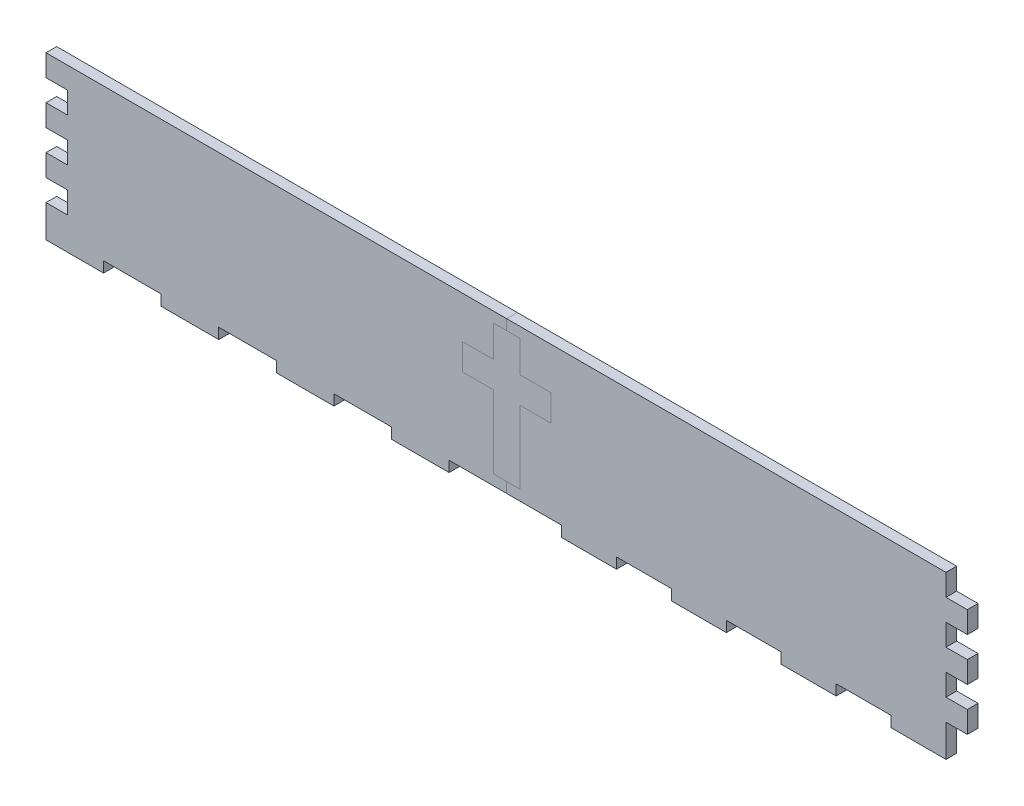
from build123d import *

# Parameters (mm, degrees)
SKETCH1_W             = 444.5
SKETCH1_H             = 73.025
BOSS_EXTRUDE1_DEPTH   = 5.15
SKETCH3_W             = 3.175
SKETCH3_H             = 73.025
BOSS_EXTRUDE2_DEPTH   = 441.325
SKETCH4_W             = 3.175
SKETCH4_H             = 73.025
BOSS_EXTRUDE3_DEPTH   = 438.15
SPLIT2_DEPTH          = 73.025
SPLIT2_START          = 5
SPLIT2_2_OUTLINE_W    = 6.35
SPLIT2_2_OUTLINE_H    = 5.15
SPLIT2_2_OUTLINE_H_2  = 3.175
SPLIT2_2_DEPTH        = 63.025
SPLIT2_START_2        = 40.085
SPLIT2_3_OUTLINE_W    = 15
SPLIT2_3_OUTLINE_H    = 5.15
SPLIT2_3_OUTLINE_H_2  = 3.175
SPLIT2_3_DEPTH        = 12.7
SPLIT2_START_3        = 215.9
SPLIT2_4_OUTLINE_W    = 63.025
SPLIT2_4_OUTLINE_H    = 5.15
SPLIT2_4_DEPTH        = 12.7
SPLIT2_START_4        = 200.9
SPLIT2_5_OUTLINE_W    = 12.7
SPLIT2_5_OUTLINE_H    = 5.15
SPLIT2_5_DEPTH        = 42.7
SPLIT2_6_DEPTH        = 73.025
SPLIT2_7_OUTLINE_W    = 15
SPLIT2_7_OUTLINE_H    = 5.15
SPLIT2_7_OUTLINE_H_2  = 3.175
SPLIT2_7_DEPTH        = 40.085
SPLIT2_START_5        = 52.785
SPLIT2_8_OUTLINE_W    = 15
SPLIT2_8_OUTLINE_H    = 5.15
SPLIT2_8_OUTLINE_H_2  = 3.175
SPLIT2_8_DEPTH        = 20.24
SPLIT2_9_OUTLINE_W    = 6.35
SPLIT2_9_OUTLINE_H    = 5.15
SPLIT2_9_OUTLINE_H_2  = 3.175
SPLIT2_9_DEPTH        = 5
SPLIT2_START_6        = 68.025
SPLIT2_10_OUTLINE_W   = 6.35
SPLIT2_10_OUTLINE_H   = 5.15
SPLIT2_10_OUTLINE_H_2 = 3.175
SPLIT2_10_DEPTH       = 5
SPLIT2_11_OUTLINE_W   = 63.025
SPLIT2_11_OUTLINE_H   = 3.175
SPLIT2_11_DEPTH       = 12.7
SPLIT2_12_OUTLINE_W   = 12.7
SPLIT2_12_OUTLINE_H   = 3.175
SPLIT2_12_DEPTH       = 42.7
SKETCH8_W             = 441.325
SKETCH8_H             = 73.025
CUT_EXTRUDE2_DEPTH    = 631.619264097
SKETCH9_W             = 10.300000228
SKETCH9_H             = 10.432142857
SKETCH9_H_2           = 10.432142858
CUT_EXTRUDE3_DEPTH    = 451.48798333
CUT_EXTRUDE4_DEPTH    = 1.27
CUT_EXTRUDE5_DEPTH    = 0.5
SKETCH12_W            = 209.409999772
SKETCH12_H            = 0.79375
BOSS_EXTRUDE4_DEPTH   = 0.5
SKETCH13_W            = 209.409999772
SKETCH13_H            = 0.79375
BOSS_EXTRUDE5_DEPTH   = 0.5
CUT_EXTRUDE6_DEPTH    = 1.27
SKETCH15_W            = 26.493749972
SKETCH15_H            = 5.15
BOSS_EXTRUDE6_DEPTH   = 5.15
SKETCH16_W            = 27.78125
SKETCH16_H            = 5.15
BOSS_EXTRUDE7_DEPTH   = 5.15


# Read off the part's stored shape, not the designer's step: Split2
with BuildPart() as part:
    # Sketch1 → Boss-Extrude1 (new body)
    with BuildSketch(Plane.XY):
        with Locations((222.25, 36.5125)):
            Rectangle(SKETCH1_W, SKETCH1_H)
    extrude(amount=BOSS_EXTRUDE1_DEPTH)

    # Sketch3 → Boss-Extrude2 (add)
    with BuildSketch(Plane(origin=(0, 0, 0), x_dir=(-1, 0, 0), z_dir=(0, 0, -1))):
        with Locations((-442.9125, 36.5125)):
            Rectangle(SKETCH3_W, SKETCH3_H)
        with Locations((-1.5875, 36.5125)):
            Rectangle(SKETCH3_W, SKETCH3_H)
    extrude(amount=BOSS_EXTRUDE2_DEPTH)

    # Sketch4 → Boss-Extrude3 (add)
    with BuildSketch(Plane(origin=(3.175, 0, 0), x_dir=(0, 0, -1), z_dir=(1, 0, 0))):
        with Locations((439.7375, 36.5125)):
            Rectangle(SKETCH4_W, SKETCH4_H)
    extrude(amount=BOSS_EXTRUDE3_DEPTH)

    # Split2 outline → Split2 (cut)
    with BuildSketch(Plane(origin=(0, 0, 0), x_dir=(1, 0, 0), z_dir=(0, 1, 0))):
        Polygon((222.25, -5.15), (222.25, 0), (3.175, 0), (3.175, 438.15), (222.25, 438.15), (222.25, 441.325), (0, 441.325), (0, -5.15), align=None)
    extrude(amount=SPLIT2_DEPTH, mode=Mode.SUBTRACT)

    # Split2 2 outline → Split2 2 (cut)
    with BuildSketch(Plane(origin=(0, 0, 0), x_dir=(1, 0, 0), z_dir=(0, 1, 0)).offset(SPLIT2_START)):
        with Locations((225.425, -2.575)):
            Rectangle(SPLIT2_2_OUTLINE_W, SPLIT2_2_OUTLINE_H)
        with Locations((225.425, 439.7375)):
            Rectangle(SPLIT2_2_OUTLINE_W, SPLIT2_2_OUTLINE_H_2)
    extrude(amount=SPLIT2_2_DEPTH, mode=Mode.SUBTRACT)

    # Split2 3 outline → Split2 3 (cut)
    with BuildSketch(Plane(origin=(0, 0, 0), x_dir=(1, 0, 0), z_dir=(0, 1, 0)).offset(SPLIT2_START_2)):
        with Locations((236.1, -2.575)):
            Rectangle(SPLIT2_3_OUTLINE_W, SPLIT2_3_OUTLINE_H)
        with Locations((236.1, 439.7375)):
            Rectangle(SPLIT2_3_OUTLINE_W, SPLIT2_3_OUTLINE_H_2)
    extrude(amount=SPLIT2_3_DEPTH, mode=Mode.SUBTRACT)


with BuildPart() as body_2:
    # Split2 4 outline → Split2 4 (new body)
    with BuildSketch(Plane.YZ.offset(SPLIT2_START_3)):
        with Locations((36.5125, 2.575)):
            Rectangle(SPLIT2_4_OUTLINE_W, SPLIT2_4_OUTLINE_H)
    extrude(amount=SPLIT2_4_DEPTH)

    # Split2 5 outline → Split2 5 (add)
    with BuildSketch(Plane.YZ.offset(SPLIT2_START_4)):
        with Locations((46.435, 2.575)):
            Rectangle(SPLIT2_5_OUTLINE_W, SPLIT2_5_OUTLINE_H)
    extrude(amount=SPLIT2_5_DEPTH)

    # Sketch10 → Cut-Extrude4 (cut)
    with BuildSketch(Plane(origin=(0, 0, 0), x_dir=(-1, 0, 0), z_dir=(0, 0, -1))):
        Polygon((-221.605097539, 47.079902461), (-221.605097539, 50.537734263), (-220.608306087, 50.537734263), (-220.608306087, 51.172671527), (-223.891693913, 51.172671527), (-223.891693913, 50.537734263), (-222.894902461, 50.537734263), (-222.894902461, 47.079902461), (-226.352734263, 47.079902461), (-226.352734263, 48.076693913), (-226.987671527, 48.076693913), (-226.987671527, 44.793306087), (-226.352734263, 44.793306087), (-226.352734263, 45.790097539), (-222.894902461, 45.790097539), (-222.894902461, 42.332265737), (-223.891693913, 42.332265737), (-223.891693913, 41.697328473), (-220.608306087, 41.697328473), (-220.608306087, 42.332265737), (-221.605097539, 42.332265737), (-221.605097539, 45.790097539), (-218.147265737, 45.790097539), (-218.147265737, 44.793306087), (-217.512328473, 44.793306087), (-217.512328473, 48.076693913), (-218.147265737, 48.076693913), (-218.147265737, 47.079902461), align=None)
        Polygon((-223.595595669, 49.126604424), (-223.595595669, 48.491032301), (-224.306032301, 48.491032301), (-224.306032301, 47.780595669), (-224.941604424, 47.780595669), (-224.941604424, 48.491032301), (-225.652041056, 48.491032301), (-225.652041056, 49.126604424), (-224.941604424, 49.126604424), (-224.941604424, 49.837041056), (-224.306032301, 49.837041056), (-224.306032301, 49.126604424), align=None)
        Polygon((-219.558395576, 48.491032301), (-219.558395576, 47.780595669), (-220.193967699, 47.780595669), (-220.193967699, 48.491032301), (-220.904404331, 48.491032301), (-220.904404331, 49.126604424), (-220.193967699, 49.126604424), (-220.193967699, 49.837041056), (-219.558395576, 49.837041056), (-219.558395576, 49.126604424), (-218.847958944, 49.126604424), (-218.847958944, 48.491032301), align=None)
        Polygon((-220.193967699, 43.743395576), (-220.904404331, 43.743395576), (-220.904404331, 44.378967699), (-220.193967699, 44.378967699), (-220.193967699, 45.089404331), (-219.558395576, 45.089404331), (-219.558395576, 44.378967699), (-218.847958944, 44.378967699), (-218.847958944, 43.743395576), (-219.558395576, 43.743395576), (-219.558395576, 43.032958944), (-220.193967699, 43.032958944), align=None)
        Polygon((-224.941604424, 44.378967699), (-224.941604424, 45.089404331), (-224.306032301, 45.089404331), (-224.306032301, 44.378967699), (-223.595595669, 44.378967699), (-223.595595669, 43.743395576), (-224.306032301, 43.743395576), (-224.306032301, 43.032958944), (-224.941604424, 43.032958944), (-224.941604424, 43.743395576), (-225.652041056, 43.743395576), (-225.652041056, 44.378967699), align=None)
    extrude(amount=-CUT_EXTRUDE4_DEPTH, mode=Mode.SUBTRACT)


with BuildPart() as body_3:
    # Split2 6 outline → Split2 6 (new body)
    with BuildSketch(Plane(origin=(0, 0, 0), x_dir=(1, 0, 0), z_dir=(0, 1, 0))):
        Polygon((200.9, -5.15), (200.9, 0), (3.175, 0), (3.175, 438.15), (200.9, 438.15), (200.9, 441.325), (0, 441.325), (0, -5.15), align=None)
    extrude(amount=SPLIT2_6_DEPTH)

    # Split2 7 outline → Split2 7 (add)
    with BuildSketch(Plane(origin=(0, 0, 0), x_dir=(1, 0, 0), z_dir=(0, 1, 0))):
        with Locations((208.4, -2.575)):
            Rectangle(SPLIT2_7_OUTLINE_W, SPLIT2_7_OUTLINE_H)
        with Locations((208.4, 439.7375)):
            Rectangle(SPLIT2_7_OUTLINE_W, SPLIT2_7_OUTLINE_H_2)
    extrude(amount=SPLIT2_7_DEPTH)

    # Split2 8 outline → Split2 8 (add)
    with BuildSketch(Plane(origin=(0, 0, 0), x_dir=(1, 0, 0), z_dir=(0, 1, 0)).offset(SPLIT2_START_5)):
        with Locations((208.4, -2.575)):
            Rectangle(SPLIT2_8_OUTLINE_W, SPLIT2_8_OUTLINE_H)
        with Locations((208.4, 439.7375)):
            Rectangle(SPLIT2_8_OUTLINE_W, SPLIT2_8_OUTLINE_H_2)
    extrude(amount=SPLIT2_8_DEPTH)

    # Split2 9 outline → Split2 9 (add)
    with BuildSketch(Plane(origin=(0, 0, 0), x_dir=(1, 0, 0), z_dir=(0, 1, 0))):
        with Locations((219.075, -2.575)):
            Rectangle(SPLIT2_9_OUTLINE_W, SPLIT2_9_OUTLINE_H)
        with Locations((219.075, 439.7375)):
            Rectangle(SPLIT2_9_OUTLINE_W, SPLIT2_9_OUTLINE_H_2)
    extrude(amount=SPLIT2_9_DEPTH)

    # Split2 10 outline → Split2 10 (add)
    with BuildSketch(Plane(origin=(0, 0, 0), x_dir=(1, 0, 0), z_dir=(0, 1, 0)).offset(SPLIT2_START_6)):
        with Locations((219.075, -2.575)):
            Rectangle(SPLIT2_10_OUTLINE_W, SPLIT2_10_OUTLINE_H)
        with Locations((219.075, 439.7375)):
            Rectangle(SPLIT2_10_OUTLINE_W, SPLIT2_10_OUTLINE_H_2)
    extrude(amount=SPLIT2_10_DEPTH)


with BuildPart() as body_4:
    # Split2 11 outline → Split2 11 (new body)
    with BuildSketch(Plane.YZ.offset(SPLIT2_START_3)):
        with Locations((36.5125, -439.7375)):
            Rectangle(SPLIT2_11_OUTLINE_W, SPLIT2_11_OUTLINE_H)
    extrude(amount=SPLIT2_11_DEPTH)

    # Split2 12 outline → Split2 12 (add)
    with BuildSketch(Plane.YZ.offset(SPLIT2_START_4)):
        with Locations((46.435, -439.7375)):
            Rectangle(SPLIT2_12_OUTLINE_W, SPLIT2_12_OUTLINE_H)
    extrude(amount=SPLIT2_12_DEPTH)


with BuildPart() as cut_extrude2_tool:
    # Sketch8 → Cut-Extrude2 (new, through all)
    with BuildSketch(Plane(origin=(444.5, 0, 0), x_dir=(0, 0, -1), z_dir=(1, 0, 0))):
        with Locations((220.6625, 36.5125)):
            Rectangle(SKETCH8_W, SKETCH8_H)
    extrude(amount=-CUT_EXTRUDE2_DEPTH)


with BuildPart() as part_1:
    add(part.part)

    # Cut-Extrude2: cut by cut_extrude2_tool
    add(cut_extrude2_tool.part, mode=Mode.SUBTRACT)


with BuildPart() as body_3_1:
    add(body_3.part)

    # Cut-Extrude2: cut by cut_extrude2_tool
    add(cut_extrude2_tool.part, mode=Mode.SUBTRACT)


with BuildPart() as body_4_1:
    add(body_4.part)

    # Cut-Extrude2: cut by cut_extrude2_tool
    add(cut_extrude2_tool.part, mode=Mode.SUBTRACT)


with BuildPart() as cut_extrude3_tool:
    # Sketch9 → Cut-Extrude3 (new, through all)
    with BuildSketch(Plane(origin=(0, 0, 0), x_dir=(-1, 0, 0), z_dir=(0, 0, -1))):
        with Locations((-439.349999886, 67.808928572)):
            Rectangle(SKETCH9_W, SKETCH9_H)
        with Locations((-439.349999886, 46.944642857)):
            Rectangle(SKETCH9_W, SKETCH9_H)
        with Locations((-439.349999886, 26.080357143)):
            Rectangle(SKETCH9_W, SKETCH9_H)
        with Locations((-439.349999886, 5.216071429)):
            Rectangle(SKETCH9_W, SKETCH9_H)
        with Locations((-5.150000114, 57.376785715)):
            Rectangle(SKETCH9_W, SKETCH9_H)
        with Locations((-5.150000114, 36.5125)):
            Rectangle(SKETCH9_W, SKETCH9_H_2)
        with Locations((-5.150000114, 15.648214285)):
            Rectangle(SKETCH9_W, SKETCH9_H)
    extrude(amount=-CUT_EXTRUDE3_DEPTH)


with BuildPart() as part_2:
    add(part_1.part)

    # Cut-Extrude3: cut by cut_extrude3_tool
    add(cut_extrude3_tool.part, mode=Mode.SUBTRACT)


with BuildPart() as body_3_2:
    add(body_3_1.part)

    # Cut-Extrude3: cut by cut_extrude3_tool
    add(cut_extrude3_tool.part, mode=Mode.SUBTRACT)


with BuildPart() as cut_extrude5_tool:
    # Sketch11 → Cut-Extrude5 (new body)
    with BuildSketch(Plane(origin=(0, 0, 0), x_dir=(-1, 0, 0), z_dir=(0, 0, -1))):
        Polygon((-15.958719574, 48.185), (-15.958719574, 44.685), (-140.62373089, 46.06), (-140.62373089, 46.81), align=None)
        Polygon((-140.864769585, 40.155453505), (-16.502495546, 31.36452255), (-16.787778038, 27.876168511), (-140.925901548, 39.407949068), align=None)
        Polygon((-141.647413562, 33.542696355), (-18.415487214, 14.644336641), (-18.98415369, 11.190842984), (-141.769270664, 32.802662), align=None)
        Polygon((-142.966454452, 27.015735359), (-21.684963934, -1.864287649), (-22.533230013, -5.259938493), (-143.148225755, 26.288095893), align=None)
        Polygon((-144.813114257, 20.618006366), (-26.289167878, -18.051488148), (-27.41138849, -21.366698684), (-145.053590103, 19.907604108), align=None)
        Polygon((-147.175103761, 14.392085205), (-32.197458828, -33.809541708), (-33.586165779, -37.022249756), (-147.472683822, 13.703647766), align=None)
        Polygon((-150.036704313, 8.379404356), (-39.370518084, -49.033581082), (-41.016469759, -52.122406601), (-150.389408243, 7.717513174), align=None)
        Polygon((-153.378872433, 2.619977217), (-47.760610119, -63.622292801), (-49.65285298, -66.566680166), (-153.784353046, 1.989037068), align=None)
        Polygon((-157.179366544, -2.847868174), (-57.311900255, -77.478591394), (-59.437841738, -80.258946193), (-157.634925433, -3.443658488), align=None)
        Polygon((-161.412894985, -7.987744209), (-67.960826231, -90.510265481), (-70.306318548, -93.108084911), (-161.915500481, -8.544419801), align=None)
        Polygon((-166.051284322, -12.76544586), (-79.636521204, -102.63059142), (-82.185955488, -105.028587422), (-166.597591669, -13.279302146), align=None)
        Polygon((-171.06366684, -17.149178311), (-92.261285348, -113.758910442), (-94.997695536, -115.941124749), (-171.650040452, -17.616795662), align=None)
        Polygon((-176.41668596, -21.109768546), (-105.751102941, -123.821165421), (-108.656278675, -125.773075755), (-177.039223617, -21.528035047), align=None)
        Polygon((-182.074718223, -24.620859491), (-120.016201474, -132.750393709), (-123.070809288, -134.45901043), (-182.729277041, -24.986991646), align=None)
        Polygon((-188.000110358, -27.659085414), (-134.961649068, -140.487172765), (-138.145361052, -141.941125311), (-188.682334355, -27.970646674), align=None)
        Polygon((-194.153429858, -30.204227424), (-150.487986236, -146.980015602), (-153.779615311, -148.169628157), (-194.858778945, -30.4591444), align=None)
        Polygon((-200.493727396, -32.239348019), (-166.491887766, -152.185713421), (-169.869528684, -153.103069311), (-201.217507592, -32.435924281), align=None)
        Polygon((-206.978809339, -33.750903809), (-182.866850333, -156.069623162), (-186.308025451, -156.708617535), (-207.716204007, -33.887831174), align=None)
        Polygon((-213.565518536, -34.728835638), (-199.503901264, -158.605898047), (-202.985710129, -158.962278501), (-214.311620435, -34.805202879), align=None)
        Polygon((-220.210021524, -35.166635533), (-216.292323728, -159.777659585), (-219.791595477, -159.849054466), (-220.95986547, -35.181934436), align=None)
        Polygon((-226.868100233, -35.061390006), (-233.120393546, -159.577109896), (-236.613841102, -159.363044083), (-227.616696138, -35.015518761), align=None)
        Polygon((-233.495446246, -34.41379945), (-249.876122688, -158.005583606), (-253.340497734, -157.507481672), (-234.237812328, -34.307063322), align=None)
        Polygon((-240.047955671, -33.228173473), (-266.448004541, -155.073538961), (-269.860252234, -154.294715693), (-240.779151605, -33.061282773), align=None)
        Polygon((-246.482022636, -31.51240222), (-282.725755966, -150.800488237), (-286.06316836, -149.746126574), (-247.197182435, -31.286467578), align=None)
        Polygon((-252.754829489, -29.277903865), (-298.601051213, -145.21486788), (-301.841418379, -143.891984425), (-253.449193882, -28.994428839), align=None)
        Polygon((-258.824631735, -26.539548627), (-313.968242812, -138.353849272), (-317.09000064, -136.771247596), (-259.493579841, -26.200419697), align=None)
        Polygon((-264.651035841, -23.315559808), (-328.725064637, -130.26309136), (-331.707438344, -128.431303417), (-265.290115921, -22.92303382), align=None)
        Polygon((-270.195268049, -19.627392521), (-342.773312474, -120.996436804), (-345.596454856, -118.92765284), (-270.800227131, -19.184081672), align=None)
        Polygon((-275.420432408, -15.499590911), (-356.019497551, -110.615553659), (-358.664621061, -108.323541091), (-275.987244589, -15.008445361), align=None)
        Polygon((-280.291756313, -10.959624818), (-368.375468693, -99.189524992), (-370.82497047, -96.689536784), (-280.816649551, -10.423913059), align=None)
        Polygon((-284.776821905, -6.037706966), (-379.758998949, -86.794389137), (-381.996577964, -84.103062298), (-285.256303122, -5.460994072), align=None)
        Polygon((-288.845781814, -0.766591906), (-390.094332804, -73.512633679), (-392.105098337, -70.647878546), (-289.276660142, -0.152715806), align=None)
        Polygon((-292.471557782, 4.81864196), (-399.312690318, -59.432646508), (-401.083261055, -56.413527554), (-292.850965797, 5.465596022), align=None)
        Polygon((-295.630020869, 10.680825823), (-407.35272484, -44.648127617), (-408.871317927, -41.49473658), (-295.955433673, 11.356552474), align=None)
        Polygon((-298.300152024, 16.780947815), (-414.160931268, -29.25746554), (-415.417440718, -25.990787716), (-298.569404049, 17.480950206), align=None)
        Polygon((-300.464181965, 23.078412633), (-419.692002112, -13.363082592), (-420.678066061, -10.004857185), (-300.675481382, 23.798032363), align=None)
        Polygon((-302.107709429, 29.531311686), (-423.909129007, 2.929246729), (-424.618185363, 6.356671284), (-302.259650076, 30.265759805), align=None)
        Polygon((-303.219797012, 36.096701995), (-426.784247671, 19.51109966), (-427.21157778, 22.984914419), (-303.31136775, 36.841090872), align=None)
        Polygon((-303.793043956, 42.730891973), (-428.298224661, 36.272126706), (-428.440984713, 39.769214003), (-303.823635395, 43.480267822), align=None)
        Polygon((-303.823635395, 49.389732178), (-428.440984713, 53.100785996), (-428.298224661, 56.597873294), (-303.793043956, 50.139108027), align=None)
        Polygon((-303.31136775, 56.028909127), (-427.21157778, 69.885085581), (-426.784247671, 73.35890034), (-303.219797012, 56.773298004), align=None)
        Polygon((-302.259650076, 62.604240195), (-424.618185363, 86.513328715), (-423.909129007, 89.940753271), (-302.107709429, 63.338688314), align=None)
        Polygon((-300.675481382, 69.071967637), (-420.678066061, 102.874857184), (-419.692002112, 106.233082592), (-300.464181965, 69.791587367), align=None)
        Polygon((-298.569404049, 75.389049793), (-415.417440718, 118.860787716), (-414.160931268, 122.12746554), (-298.300152024, 76.089052184), align=None)
        Polygon((-295.955433673, 81.513447526), (-408.871317927, 134.36473658), (-407.35272484, 137.518127617), (-295.630020869, 82.189174177), align=None)
        Polygon((-292.850965797, 87.404403978), (-401.083261056, 149.283527554), (-399.312690318, 152.302646508), (-292.471557782, 88.05135804), align=None)
        Polygon((-289.276660142, 93.022715806), (-392.105098337, 163.517878546), (-390.094332805, 166.382633679), (-288.845781814, 93.636591906), align=None)
        Polygon((-285.256303123, 98.330994071), (-381.996577964, 176.973062298), (-379.758998949, 179.664389137), (-284.776821905, 98.907706965), align=None)
        Polygon((-280.816649551, 103.293913059), (-370.82497047, 189.559536783), (-368.375468693, 192.059524992), (-280.291756313, 103.829624818), align=None)
        Polygon((-275.987244589, 107.878445361), (-358.664621061, 201.19354109), (-356.019497551, 203.485553659), (-275.420432408, 108.369590911), align=None)
        Polygon((-270.800227131, 112.054081671), (-345.596454856, 211.79765284), (-342.773312474, 213.866436803), (-270.195268049, 112.497392521), align=None)
        Polygon((-265.290115921, 115.79303382), (-331.707438345, 221.301303417), (-328.725064637, 223.13309136), (-264.651035841, 116.185559807), align=None)
        Polygon((-259.493579841, 119.070419696), (-317.09000064, 229.641247596), (-313.968242812, 231.223849272), (-258.824631735, 119.409548627), align=None)
        Polygon((-253.449193882, 121.864428839), (-301.841418379, 236.761984425), (-298.601051214, 238.08486788), (-252.754829489, 122.147903865), align=None)
        Polygon((-247.197182435, 124.156467577), (-286.06316836, 242.616126573), (-282.725755966, 243.670488237), (-246.482022636, 124.38240222), align=None)
        Polygon((-240.779151605, 125.931282772), (-269.860252234, 247.164715692), (-266.448004541, 247.943538961), (-240.047955671, 126.098173473), align=None)
        Polygon((-234.237812328, 127.177063322), (-253.340497734, 250.377481671), (-249.876122688, 250.875583605), (-233.495446247, 127.28379945), align=None)
        Polygon((-227.616696138, 127.885518761), (-236.613841102, 252.233044083), (-233.120393546, 252.447109896), (-226.868100233, 127.931390006), align=None)
        Polygon((-220.959865471, 128.051934436), (-219.791595477, 252.719054466), (-216.292323728, 252.647659585), (-220.210021524, 128.036635533), align=None)
        Polygon((-214.311620436, 127.675202878), (-202.985710129, 251.832278501), (-199.503901264, 251.475898047), (-213.565518536, 127.598835638), align=None)
        Polygon((-207.716204007, 126.757831174), (-186.308025451, 249.578617535), (-182.866850333, 248.939623162), (-206.978809339, 126.620903809), align=None)
        Polygon((-201.217507593, 125.305924281), (-169.869528684, 245.973069311), (-166.491887766, 245.055713421), (-200.493727396, 125.109348019), align=None)
        Polygon((-194.858778945, 123.3291444), (-153.779615311, 241.039628157), (-150.487986236, 239.850015602), (-194.153429858, 123.074227423), align=None)
        Polygon((-188.682334355, 120.840646674), (-138.145361052, 234.811125311), (-134.961649068, 233.357172765), (-188.000110358, 120.529085414), align=None)
        Polygon((-182.729277041, 117.856991645), (-123.070809288, 227.32901043), (-120.016201474, 225.620393709), (-182.074718223, 117.490859491), align=None)
        Polygon((-177.039223618, 114.398035046), (-108.656278675, 218.643075755), (-105.751102941, 216.691165421), (-176.41668596, 113.979768546), align=None)
        Polygon((-171.650040452, 110.486795662), (-94.997695537, 208.811124749), (-92.261285348, 206.628910442), (-171.06366684, 110.019178311), align=None)
        Polygon((-166.597591669, 106.149302146), (-82.185955489, 197.898587422), (-79.636521204, 195.50059142), (-166.051284322, 105.63544586), align=None)
        Polygon((-161.915500481, 101.414419801), (-70.306318548, 185.978084911), (-67.960826232, 183.380265481), (-161.412894985, 100.857744209), align=None)
        Polygon((-157.634925433, 96.313658488), (-59.437841738, 173.128946193), (-57.311900255, 170.348591394), (-157.179366544, 95.717868174), align=None)
        Polygon((-153.784353046, 90.880962932), (-49.65285298, 159.436680166), (-47.760610119, 156.492292801), (-153.378872433, 90.250022783), align=None)
        Polygon((-150.389408243, 85.152486826), (-41.016469759, 144.992406601), (-39.370518084, 141.903581082), (-150.036704313, 84.490595644), align=None)
        Polygon((-147.472683822, 79.166352234), (-33.586165779, 129.892249756), (-32.197458828, 126.679541708), (-147.175103761, 78.477914795), align=None)
        Polygon((-145.053590103, 72.962395892), (-27.41138849, 114.236698684), (-26.289167878, 110.921488148), (-144.813114257, 72.251993634), align=None)
        Polygon((-143.148225755, 66.581904107), (-22.533230013, 98.129938493), (-21.684963934, 94.734287649), (-142.966454452, 65.854264641), align=None)
        Polygon((-141.769270664, 60.067338), (-18.98415369, 81.679157016), (-18.415487214, 78.225663359), (-141.647413562, 59.327303645), align=None)
        Polygon((-140.925901548, 53.462050932), (-16.787778038, 64.993831489), (-16.502495546, 61.50547745), (-140.864769585, 52.714546495), align=None)
    extrude(amount=-CUT_EXTRUDE5_DEPTH)


with BuildPart() as part_3:
    add(part_2.part)

    # Cut-Extrude5: cut by cut_extrude5_tool
    add(cut_extrude5_tool.part, mode=Mode.SUBTRACT)

    # Sketch13 → Boss-Extrude5 (add)
    with BuildSketch(Plane(origin=(0, 0, 0), x_dir=(-1, 0, 0), z_dir=(0, 0, -1))):
        with Locations((-329.494999886, 0.396875)):
            Rectangle(SKETCH13_W, SKETCH13_H)
        with Locations((-329.494999886, 72.628125)):
            Rectangle(SKETCH13_W, SKETCH13_H)
    extrude(amount=-BOSS_EXTRUDE5_DEPTH)


with BuildPart() as body_3_3:
    add(body_3_2.part)

    # Cut-Extrude5: cut by cut_extrude5_tool
    add(cut_extrude5_tool.part, mode=Mode.SUBTRACT)

    # Sketch12 → Boss-Extrude4 (add)
    with BuildSketch(Plane(origin=(0, 0, 0), x_dir=(-1, 0, 0), z_dir=(0, 0, -1))):
        with Locations((-115.005000114, 0.396875)):
            Rectangle(SKETCH12_W, SKETCH12_H)
        with Locations((-115.005000114, 72.628125)):
            Rectangle(SKETCH12_W, SKETCH12_H)
    extrude(amount=-BOSS_EXTRUDE4_DEPTH)

    # Sketch14 → Cut-Extrude6 (cut)
    with BuildSketch(Plane(origin=(0, 0, 0), x_dir=(-1, 0, 0), z_dir=(0, 0, -1))):
        with BuildLine():
            add(Edge.make_bspline(
                [(-183.621855506, 46.435), (-179.283135932, 42.118971895), (-177.369642252, 51.661467915), (-173.085282359, 46.435)],
                knots=[0, 0, 0, 0, 1, 1, 1, 1], degree=3))
            add(Edge.make_bspline(
                [(-173.085282359, 46.435), (-177.099895112, 47.7341772), (-180.431464045, 40.446391226), (-183.621855506, 46.435)],
                knots=[0, 0, 0, 0, 1, 1, 1, 1], degree=3))
        make_face()
        with BuildLine():
            add(Edge.make_bspline(
                [(-184.835432184, 36.828571419), (-181.706374007, 31.569143592), (-177.47987399, 40.335978024), (-174.629884859, 34.208232232)],
                knots=[0, 0, 0, 0, 1, 1, 1, 1], degree=3))
            add(Edge.make_bspline(
                [(-174.629884859, 34.208232232), (-178.195278938, 36.464986984), (-183.234579179, 30.234687709), (-184.835432184, 36.828571419)],
                knots=[0, 0, 0, 0, 1, 1, 1, 1], degree=3))
        make_face()
        with BuildLine():
            add(Edge.make_bspline(
                [(-188.39990376, 27.825750703), (-186.677117211, 21.953392348), (-180.403177399, 29.393712744), (-179.166634327, 22.749717877)],
                knots=[0, 0, 0, 0, 1, 1, 1, 1], degree=3))
            add(Edge.make_bspline(
                [(-179.166634327, 22.749717877), (-182.05878291, 25.82224998), (-188.489176691, 21.040910022), (-188.39990376, 27.825750703)],
                knots=[0, 0, 0, 0, 1, 1, 1, 1], degree=3))
        make_face()
        with BuildLine():
            add(Edge.make_bspline(
                [(-194.091301374, 19.99221819), (-193.88303547, 13.875911178), (-185.955870574, 19.522214843), (-186.410470109, 12.779437536)],
                knots=[0, 0, 0, 0, 1, 1, 1, 1], degree=3))
            add(Edge.make_bspline(
                [(-186.410470109, 12.779437536), (-188.447648865, 16.474688498), (-195.865090895, 13.44273703), (-194.091301374, 19.99221819)],
                knots=[0, 0, 0, 0, 1, 1, 1, 1], degree=3))
        make_face()
        with BuildLine():
            add(Edge.make_bspline(
                [(-188.399894125, 65.044251771), (-182.518582782, 63.352281607), (-185.438908005, 72.636267224), (-179.166624692, 70.120284596)],
                knots=[0, 0, 0, 0, 1, 1, 1, 1], degree=3))
            add(Edge.make_bspline(
                [(-179.166624692, 70.120284596), (-183.310540054, 69.324707812), (-182.719098496, 61.333376706), (-188.399894125, 65.044251771)],
                knots=[0, 0, 0, 0, 1, 1, 1, 1], degree=3))
        make_face()
        with BuildLine():
            add(Edge.make_bspline(
                [(-184.835427211, 56.04142921), (-179.559663948, 52.939992746), (-180.079408449, 62.658560233), (-174.629879885, 58.661768397)],
                knots=[0, 0, 0, 0, 1, 1, 1, 1], degree=3))
            add(Edge.make_bspline(
                [(-174.629879885, 58.661768397), (-178.841458427, 58.921735964), (-180.255961324, 51.034381685), (-184.835427211, 56.04142921)],
                knots=[0, 0, 0, 0, 1, 1, 1, 1], degree=3))
        make_face()
    cut_extrude6 = extrude(amount=-CUT_EXTRUDE6_DEPTH, mode=Mode.SUBTRACT)

    # Sketch16 → Boss-Extrude7 (add)
    with BuildSketch(Plane(origin=(0, 0, 0), x_dir=(-1, 0, 0), z_dir=(0, 0, -1))):
        with Locations((-13.890625, -2.575)):
            Rectangle(SKETCH16_W, SKETCH16_H)
        with Locations((-69.453125, -2.575)):
            Rectangle(SKETCH16_W, SKETCH16_H)
        with Locations((-125.015625, -2.575)):
            Rectangle(SKETCH16_W, SKETCH16_H)
        with Locations((-180.578125, -2.575)):
            Rectangle(SKETCH16_W, SKETCH16_H)
    extrude(amount=-BOSS_EXTRUDE7_DEPTH)


with BuildPart() as part_4:
    add(part_3.part)

    # Mirror4: Cut-Extrude6 across plane
    add(cut_extrude6.mirror(Plane(origin=(222.25, 0, 0), x_dir=(0, 0, 1), z_dir=(1, 0, 0))), mode=Mode.SUBTRACT)

    # Sketch15 → Boss-Extrude6 (add)
    with BuildSketch(Plane(origin=(0, 0, 0), x_dir=(-1, 0, 0), z_dir=(0, 0, -1))):
        with Locations((-420.953124786, -2.575)):
            Rectangle(SKETCH15_W, SKETCH15_H)
        with Locations((-367.965624843, -2.575)):
            Rectangle(SKETCH15_W, SKETCH15_H)
        with Locations((-314.9781249, -2.575)):
            Rectangle(SKETCH15_W, SKETCH15_H)
        with Locations((-261.990624957, -2.575)):
            Rectangle(SKETCH15_W, SKETCH15_H)
    extrude(amount=-BOSS_EXTRUDE6_DEPTH)


solid = Compound([body_2.part, body_3_3.part, part_4.part])
